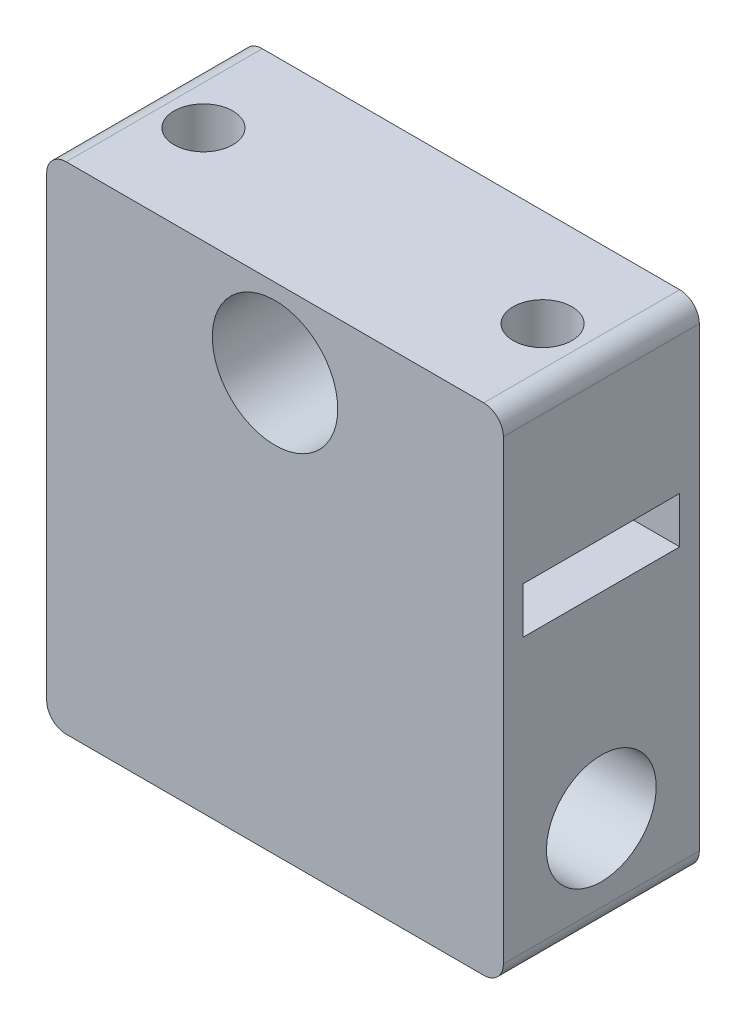
from build123d import *

# Parameters (mm, degrees)
SKETCH1_W           = 29.59652174
SKETCH1_H           = 50.8
SKETCH1_R           = 4.064
BOSS_EXTRUDE1_DEPTH = 12.7
SKETCH2_W           = 10.16
SKETCH2_H           = 3
CUT_EXTRUDE1_DEPTH  = 30.48
SKETCH3_R           = 3.556
CUT_EXTRUDE2_DEPTH  = 45.72
SKETCH4_R           = 0.762
CUT_EXTRUDE3_DEPTH  = 17.78
SKETCH5_R           = 1.905
CUT_EXTRUDE4_DEPTH  = 12.7
SKETCH7_W           = 12.7
SKETCH7_H           = 11.050531838
CUT_EXTRUDE5_DEPTH  = 62.484
SKETCH8_W           = 29.59652174
SKETCH8_H           = 2.54
CUT_EXTRUDE6_DEPTH  = 62.484
SKETCH9_W           = 12.7
SKETCH9_H           = 5.08
CUT_EXTRUDE7_DEPTH  = 62.484
FILLET1_R           = 1.27


with BuildPart() as part:
    # Sketch1 → Boss-Extrude1 (new body)
    with BuildSketch(Plane.XY):
        Rectangle(SKETCH1_W, SKETCH1_H)
        with Locations((0, 17.78)):
            Circle(SKETCH1_R, mode=Mode.SUBTRACT)
    extrude(amount=BOSS_EXTRUDE1_DEPTH)

    # Sketch2 → Cut-Extrude1 (cut)
    with BuildSketch(Plane.ZY.offset(14.79826087)):
        with Locations((6.35, 11.2)):
            Rectangle(SKETCH2_W, SKETCH2_H)
    extrude(amount=-CUT_EXTRUDE1_DEPTH, mode=Mode.SUBTRACT)

    # Sketch3 → Cut-Extrude2 (cut)
    with BuildSketch(Plane.ZY.offset(14.79826087)):
        with Locations((6.35, -3)):
            Circle(SKETCH3_R)
    extrude(amount=-CUT_EXTRUDE2_DEPTH, mode=Mode.SUBTRACT)

    # Sketch4 → Cut-Extrude3 (cut)
    with BuildSketch(Plane(origin=(0, 25.4, 0), x_dir=(1, 0, 0), z_dir=(0, 1, 0))):
        with Locations((10.98826087, -6.35)):
            Circle(SKETCH4_R)
        with Locations((-10.98826087, -6.35)):
            Circle(SKETCH4_R)
    extrude(amount=-CUT_EXTRUDE3_DEPTH, mode=Mode.SUBTRACT)

    # Sketch5 → Cut-Extrude4 (cut)
    with BuildSketch(Plane(origin=(0, 25.4, 0), x_dir=(1, 0, 0), z_dir=(0, 1, 0))):
        with Locations((-10.98826087, -6.35)):
            Circle(SKETCH5_R)
        with Locations((10.98826087, -6.35)):
            Circle(SKETCH5_R)
    extrude(amount=-CUT_EXTRUDE4_DEPTH, mode=Mode.SUBTRACT)

    # Sketch7 → Cut-Extrude5 (cut)
    with BuildSketch(Plane.ZY.offset(14.79826087)):
        with Locations((6.35, -19.874734081)):
            Rectangle(SKETCH7_W, SKETCH7_H)
    extrude(amount=-CUT_EXTRUDE5_DEPTH, mode=Mode.SUBTRACT)

    # Sketch8 → Cut-Extrude6 (cut)
    with BuildSketch(Plane.XY.offset(12.7)):
        with Locations((0, 24.13)):
            Rectangle(SKETCH8_W, SKETCH8_H)
    extrude(amount=-CUT_EXTRUDE6_DEPTH, mode=Mode.SUBTRACT)

    # Sketch9 → Cut-Extrude7 (cut)
    with BuildSketch(Plane.ZY.offset(14.79826087)):
        with Locations((6.35, -11.809468162)):
            Rectangle(SKETCH9_W, SKETCH9_H)
    extrude(amount=-CUT_EXTRUDE7_DEPTH, mode=Mode.SUBTRACT)

    # Fillet1
    fillet1_edges = [part.edges().sort_by_distance(p)[0] for p in [
        (-14.79826087, 22.86, 6.35),
        (14.79826087, 22.86, 6.35),
        (14.79826087, -9.269468162, 6.35),
        (-14.79826087, -9.269468162, 6.35),
    ]]
    fillet(fillet1_edges, radius=FILLET1_R)


solid = part.part
